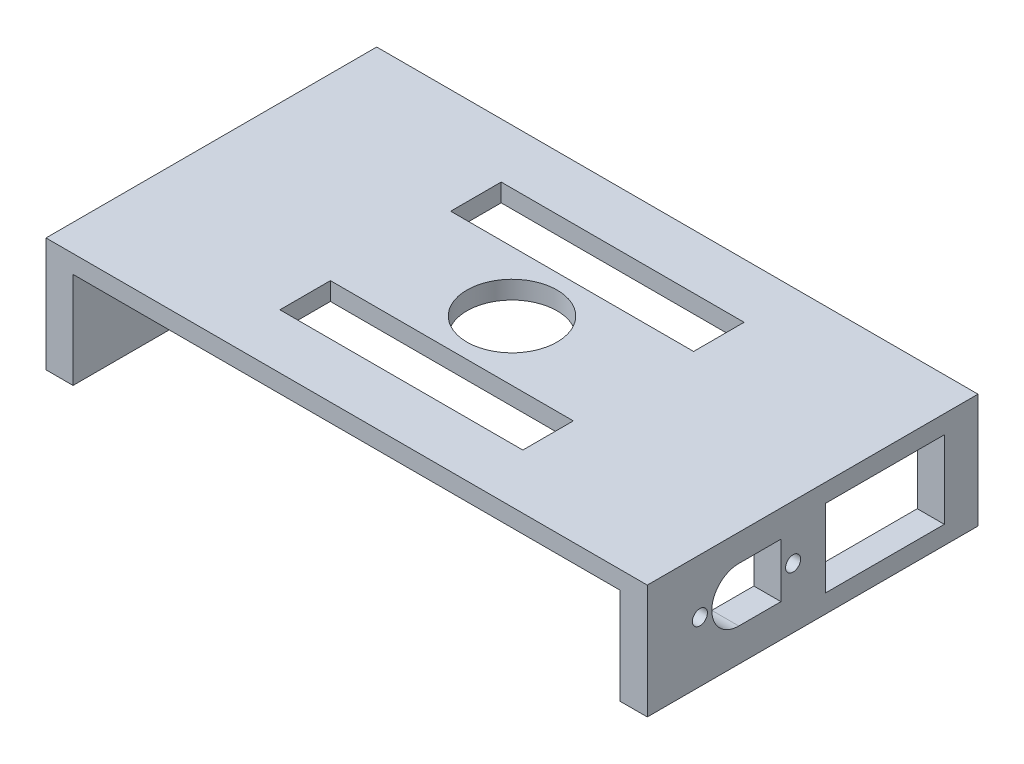
from build123d import *

# Parameters (mm, degrees)
SKETCH1_W           = 100
SKETCH1_H           = 55
BOSS_EXTRUDE1_DEPTH = 19
SKETCH2_W           = 91
SKETCH2_H           = 91
CUT_EXTRUDE1_DEPTH  = 16
CUT_EXTRUDE3_REACH  = 107.438
SKETCH3_R           = 1.25
CUT_EXTRUDE13_REACH = 107.438
SKETCH15_W          = 19.8
SKETCH15_H          = 12.9
CUT_EXTRUDE14_REACH = 62.144
SKETCH6_R           = 7.5
SKETCH6_W           = 40.4
SKETCH6_H           = 8.4


with BuildPart() as part:
    # Sketch1 → Boss-Extrude1 (new body)
    with BuildSketch(Plane(origin=(0, 0, 0), x_dir=(1, 0, 0), z_dir=(0, 1, 0))):
        Rectangle(SKETCH1_W, SKETCH1_H)
    extrude(amount=BOSS_EXTRUDE1_DEPTH)

    # Sketch2 → Cut-Extrude1 (cut)
    with BuildSketch(Plane.XZ):
        Rectangle(SKETCH2_W, SKETCH2_H)
    extrude(amount=-CUT_EXTRUDE1_DEPTH, mode=Mode.SUBTRACT)

    # Sketch3 → Cut-Extrude3 (cut, up to next)
    with BuildSketch(Plane(origin=(50, 0, 0), x_dir=(0, 0, -1), z_dir=(1, 0, 0)), mode=Mode.PRIVATE) as cut_extrude3_sk1:
        with Locations((-18.75, 10)):
            Circle(SKETCH3_R)
    cut_extrude3_tool1 = extrude(cut_extrude3_sk1.sketch, amount=-CUT_EXTRUDE3_REACH, mode=Mode.PRIVATE) & part.part
    # Sketch3 → Cut-Extrude3 (cut, up to next)
    with BuildSketch(Plane(origin=(50, 0, 0), x_dir=(0, 0, -1), z_dir=(1, 0, 0)), mode=Mode.PRIVATE) as cut_extrude3_sk2:
        with Locations((-3.25, 10)):
            Circle(SKETCH3_R)
    cut_extrude3_tool2 = extrude(cut_extrude3_sk2.sketch, amount=-CUT_EXTRUDE3_REACH, mode=Mode.PRIVATE) & part.part
    # Sketch3 → Cut-Extrude3 (cut, up to next)
    with BuildSketch(Plane(origin=(50, 0, 0), x_dir=(0, 0, -1), z_dir=(1, 0, 0)), mode=Mode.PRIVATE) as cut_extrude3_sk3:
        with BuildLine():
            Line((-5.272727273, 5.5), (-5.272727273, 14.5))
            Line((-5.272727273, 14.5), (-12.278409091, 14.5))
            ThreePointArc((-12.278409091, 14.5), (-16.778409091, 10), (-12.278409091, 5.5))
            Line((-12.278409091, 5.5), (-5.272727273, 5.5))
        make_face()
    cut_extrude3_tool3 = extrude(cut_extrude3_sk3.sketch, amount=-CUT_EXTRUDE3_REACH, mode=Mode.PRIVATE) & part.part
    add(cut_extrude3_tool1.solids().sort_by_distance((50, 10, 18.75))[0], mode=Mode.SUBTRACT)
    add(cut_extrude3_tool2.solids().sort_by_distance((50, 10, 3.25))[0], mode=Mode.SUBTRACT)
    add(cut_extrude3_tool3.solids().sort_by_distance((50, 10, 10.590569))[0], mode=Mode.SUBTRACT)

    # Sketch15 → Cut-Extrude13 (cut, up to next)
    with BuildSketch(Plane(origin=(50, 0, 0), x_dir=(0, 0, -1), z_dir=(1, 0, 0)), mode=Mode.PRIVATE) as cut_extrude13_sk1:
        with Locations((12, 9.5)):
            Rectangle(SKETCH15_W, SKETCH15_H)
    cut_extrude13_tool1 = extrude(cut_extrude13_sk1.sketch, amount=-CUT_EXTRUDE13_REACH, mode=Mode.PRIVATE) & part.part
    add(cut_extrude13_tool1.solids().sort_by_distance((50, 9.5, -12))[0], mode=Mode.SUBTRACT)

    # Sketch6 → Cut-Extrude14 (cut, up to next)
    with BuildSketch(Plane(origin=(0, 19, 0), x_dir=(1, 0, 0), z_dir=(0, 1, 0)), mode=Mode.PRIVATE) as cut_extrude14_sk1:
        Circle(SKETCH6_R)
    cut_extrude14_tool1 = extrude(cut_extrude14_sk1.sketch, amount=-CUT_EXTRUDE14_REACH, mode=Mode.PRIVATE) & part.part
    # Sketch6 → Cut-Extrude14 (cut, up to next)
    with BuildSketch(Plane(origin=(0, 19, 0), x_dir=(1, 0, 0), z_dir=(0, 1, 0)), mode=Mode.PRIVATE) as cut_extrude14_sk2:
        with Locations((0, -14.2)):
            Rectangle(SKETCH6_W, SKETCH6_H)
    cut_extrude14_tool2 = extrude(cut_extrude14_sk2.sketch, amount=-CUT_EXTRUDE14_REACH, mode=Mode.PRIVATE) & part.part
    # Sketch6 → Cut-Extrude14 (cut, up to next)
    with BuildSketch(Plane(origin=(0, 19, 0), x_dir=(1, 0, 0), z_dir=(0, 1, 0)), mode=Mode.PRIVATE) as cut_extrude14_sk3:
        with Locations((0, 14.2)):
            Rectangle(SKETCH6_W, SKETCH6_H)
    cut_extrude14_tool3 = extrude(cut_extrude14_sk3.sketch, amount=-CUT_EXTRUDE14_REACH, mode=Mode.PRIVATE) & part.part
    add(cut_extrude14_tool1.solids().sort_by_distance((0, 19, 0))[0], mode=Mode.SUBTRACT)
    add(cut_extrude14_tool2.solids().sort_by_distance((0, 19, 14.2))[0], mode=Mode.SUBTRACT)
    add(cut_extrude14_tool3.solids().sort_by_distance((0, 19, -14.2))[0], mode=Mode.SUBTRACT)


solid = part.part
